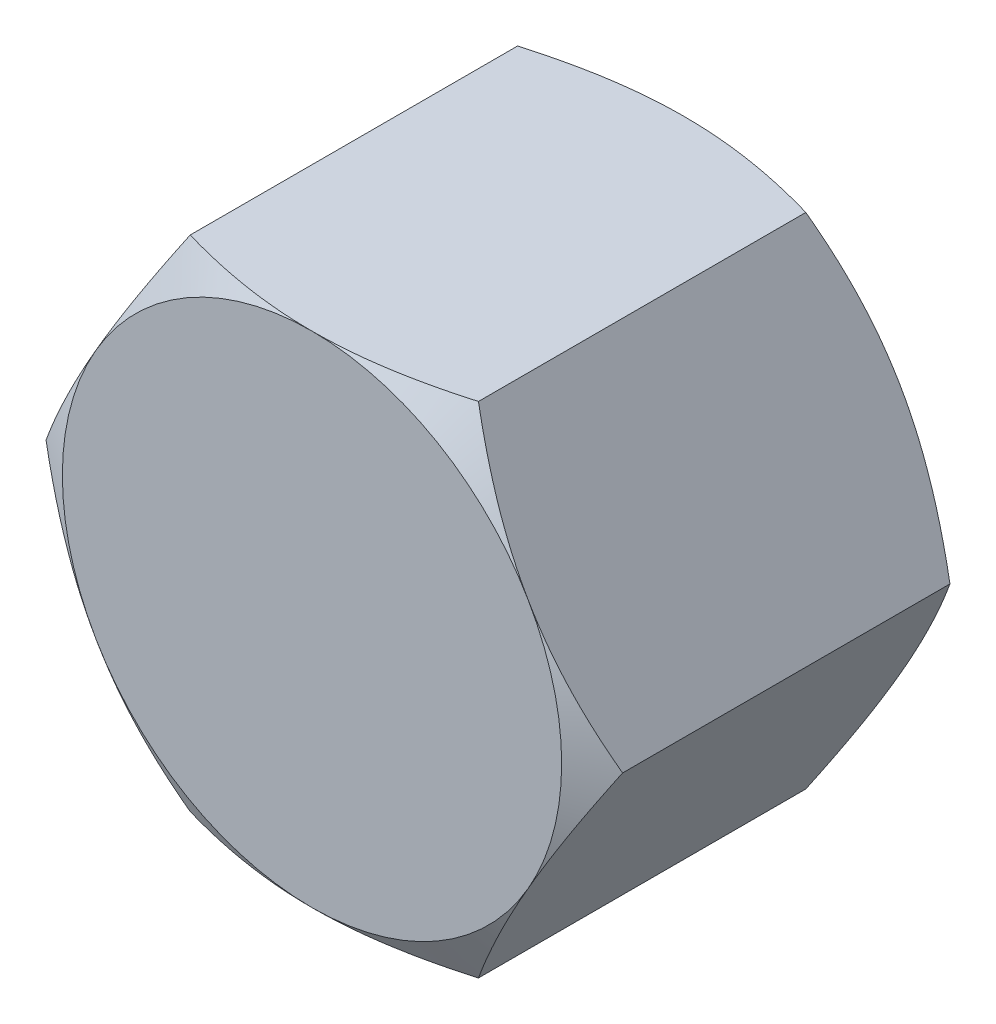
from build123d import *

# Parameters (mm, degrees)
BOSS_EXTRUDE1_DEPTH     = 6
CUT_EXTRUDE5_START      = -6
SKETCH2_OUTSIDE_W       = 53.788
SKETCH2_OUTSIDE_H       = 51.296
SKETCH2_OUTSIDE_R       = 8.054036255
CUT_EXTRUDE5_DEPTH      = 8
CUT_EXTRUDE5_DRAFT      = 60
CUT_EXTRUDE7_START      = 6
SKETCH3_OUTSIDE_W       = 53.788
SKETCH3_OUTSIDE_H       = 51.296
SKETCH3_OUTSIDE_R       = 8.054036255
CUT_EXTRUDE7_DEPTH      = 8
CUT_EXTRUDE7_DRAFT      = -60
CUT_EXTRUDE8_DEPTH      = 14.687859584
CUT_EXTRUDE8_DEPTH_BACK = 14.687859584
SKETCH4_R               = 5
CHAMFER1_SIZE           = 1
THREAD1_PITCH           = 1.5
SKETCH5_R               = 6
BOSS_EXTRUDE2_DEPTH     = 4


with BuildPart() as part:
    # Sketch1 → Boss-Extrude1 (new, symmetric)
    with BuildSketch(Plane.XY):
        Polygon((4.65, -8.054036255), (9.3, 0), (4.65, 8.054036255), (-4.65, 8.054036255), (-9.3, 0), (-4.65, -8.054036255), align=None)
    extrude(amount=BOSS_EXTRUDE1_DEPTH, both=True)


with BuildPart() as cut_extrude5_tool:
    # Sketch2 outside → Cut-Extrude5 (with draft: the straight prism first)
    with BuildSketch(Plane.XY.offset(CUT_EXTRUDE5_START)):
        Rectangle(SKETCH2_OUTSIDE_W, SKETCH2_OUTSIDE_H)
        Circle(SKETCH2_OUTSIDE_R, mode=Mode.SUBTRACT)
    extrude(amount=CUT_EXTRUDE5_DEPTH)
    # Cut-Extrude5: the draft: its side faces are tilted about the plane it starts from
    cut_extrude5_sides = [cut_extrude5_tool.faces().sort_by_distance(p)[0] for p in [
        (0, -25.648, -2),
        (26.894, 0, -2),
        (0, 25.648, -2),
        (-26.894, 0, -2),
        (-8.054036255, 0, -2),
    ]]
    draft(cut_extrude5_sides, Plane.XY.offset(CUT_EXTRUDE5_START), CUT_EXTRUDE5_DRAFT)


with BuildPart() as part_1:
    add(part.part)

    # Cut-Extrude5: cut by cut_extrude5_tool
    add(cut_extrude5_tool.part, mode=Mode.SUBTRACT)


with BuildPart() as cut_extrude7_tool:
    # Sketch3 outside → Cut-Extrude7 (with draft: the straight prism first)
    with BuildSketch(Plane.XY.offset(CUT_EXTRUDE7_START)):
        Rectangle(SKETCH3_OUTSIDE_W, SKETCH3_OUTSIDE_H)
        Circle(SKETCH3_OUTSIDE_R, mode=Mode.SUBTRACT)
    extrude(amount=-CUT_EXTRUDE7_DEPTH)
    # Cut-Extrude7: the draft: its side faces are tilted about the plane it starts from
    cut_extrude7_sides = [cut_extrude7_tool.faces().sort_by_distance(p)[0] for p in [
        (0, -25.648, 2),
        (26.894, 0, 2),
        (0, 25.648, 2),
        (-26.894, 0, 2),
        (-8.054036255, 0, 2),
    ]]
    draft(cut_extrude7_sides, Plane.XY.offset(CUT_EXTRUDE7_START), CUT_EXTRUDE7_DRAFT)


with BuildPart() as part_2:
    add(part_1.part)

    # Cut-Extrude7: cut by cut_extrude7_tool
    add(cut_extrude7_tool.part, mode=Mode.SUBTRACT)

    # Sketch4 → Cut-Extrude8 (cut, two sides: drawn at the far end of the back side and taken through both)
    with BuildSketch(Plane.XY.offset(-CUT_EXTRUDE8_DEPTH_BACK)):
        Circle(SKETCH4_R)
    extrude(amount=CUT_EXTRUDE8_DEPTH + CUT_EXTRUDE8_DEPTH_BACK, mode=Mode.SUBTRACT)

    # Chamfer1
    chamfer1_edges = [part_2.edges().sort_by_distance(p)[0] for p in [
        (-5, 0, -6),
        (-5, 0, 6),
    ]]
    chamfer(chamfer1_edges, length=CHAMFER1_SIZE)

    # Thread1: the profile of Thread Profile2 profile screwed along a right-hand helix of 8 turns, 8 arcs to a turn; built about Z, then put on its axis
    thread1_z = Axis((0, 0, 0), (0, 0, 1))
    thread1_corners = [(4.9997, 0, -0.000173205), (5.811898812, 0, 0.468749998), (5.811898812, 0, 0.656249998), (4.9997, 0, 1.125173201)]
    with BuildLine(mode=Mode.PRIVATE) as thread1_profile:
        Line(thread1_corners[0], thread1_corners[1])
        Line(thread1_corners[1], thread1_corners[2])
        Line(thread1_corners[2], thread1_corners[3])
        Line(thread1_corners[3], thread1_corners[0])
    thread1_cap = Face(thread1_profile.wire())
    thread1_turn_angles = [0, 22.5, 45, 67.5, 90, 112.5, 135, 157.5, 180, 202.5, 225, 247.5, 270, 292.5, 315, 337.5, 360]
    thread1_turn_weights = [1, 0.9238795325112867, 1, 0.9238795325112867, 1, 0.9238795325112867, 1, 0.9238795325112867, 1, 0.9238795325112867, 1, 0.9238795325112867, 1, 0.9238795325112867, 1, 0.9238795325112867, 1]
    thread1_turn_rails = [Edge.make_bspline([Vector(p[0], p[1], 0).rotate(thread1_z, thread1_turn_angles[k]) / thread1_turn_weights[k] + Vector(0, 0, p[2] + THREAD1_PITCH * thread1_turn_angles[k] / 360) for k in range(17)], [0, 0, 0, 1, 1, 2, 2, 3, 3, 4, 4, 5, 5, 6, 6, 7, 7, 8, 8, 8], 2, thread1_turn_weights) for p in thread1_corners]
    thread1_turn_sides = [Face.make_surface_from_curves(thread1_turn_rails[p[0]], thread1_turn_rails[p[1]]) for p in [(0, 1), (1, 2), (2, 3), (3, 0)]]
    thread1 = Plane(origin=(0, 0, -6), x_dir=(1, 0, 0), z_dir=(0, 0, 1)) * Solid(Shell([*[p.moved(Location((0, 0, THREAD1_PITCH * i))) for i in range(8) for p in thread1_turn_sides], thread1_cap, thread1_cap.rotate(thread1_z, 2880).moved(Location((0, 0, THREAD1_PITCH * 2880 / 360)))]))
    add(thread1, mode=Mode.SUBTRACT)

    # Sketch5 → Boss-Extrude2 (add)
    with BuildSketch(Plane.XY.offset(6)):
        Circle(SKETCH5_R)
    extrude(amount=-BOSS_EXTRUDE2_DEPTH)


solid = part_2.part
